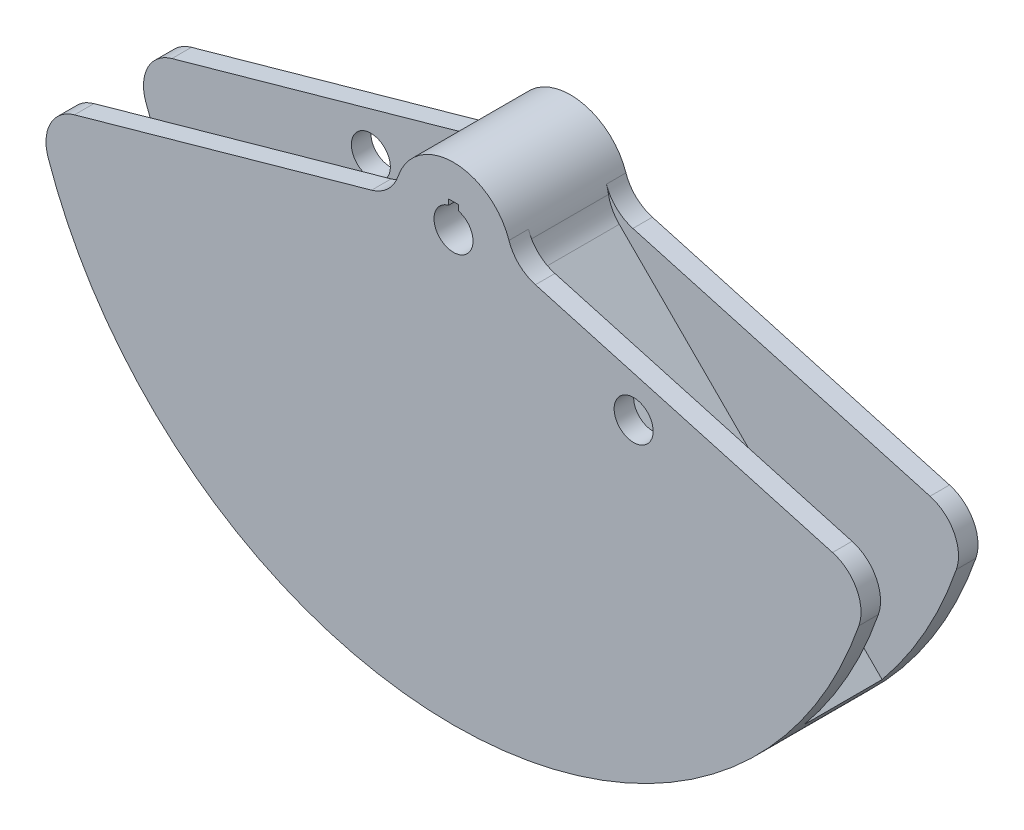
from build123d import *

# Parameters (mm, degrees)
SKETCH1_R               = 12.7
BOSS_EXTRUDE1_DEPTH     = 25.4
BOSS_EXTRUDE2_START     = 12.7
SKETCH5_R               = 12.7
BOSS_EXTRUDE2_DEPTH     = 12.7
SKETCH6_R               = 12.7
BOSS_EXTRUDE4_DEPTH     = 12.7
CUT_EXTRUDE1_DEPTH      = 388.27234671
CUT_EXTRUDE1_DEPTH_BACK = 388.27234671
SKETCH8_W               = 6.35
SKETCH8_H               = 6.35


with BuildPart() as part:
    # Sketch1 → Boss-Extrude1 (new, symmetric)
    with BuildSketch(Plane.XY):
        with BuildLine():
            Line((-215.695054603, -177.595054603), (-44.473355081, -6.373355081))
            ThreePointArc((-44.473355081, -6.373355081), (-39.956621227, -0.242188042), (-37.460320394, 6.952294297))
            ThreePointArc((-37.460320394, 6.952294297), (0, 38.1), (37.460320394, 6.952294297))
            ThreePointArc((37.460320394, 6.952294297), (39.956621227, -0.242188042), (44.473355081, -6.373355081))
            Line((44.473355081, -6.373355081), (215.695054603, -177.595054603))
            ThreePointArc((215.695054603, -177.595054603), (0, -279.4), (-215.695054603, -177.595054603))
        make_face()
        Circle(SKETCH1_R, mode=Mode.SUBTRACT)
    extrude(amount=BOSS_EXTRUDE1_DEPTH, both=True)

    # Sketch5 → Boss-Extrude2 (add)
    with BuildSketch(Plane.XY.offset(25.4).offset(BOSS_EXTRUDE2_START)):
        with BuildLine():
            Line((-246.90917958, -58.560550716), (-53.349403067, -4.276696281))
            ThreePointArc((-53.349403067, -4.276696281), (-42.702025606, 1.776101798), (-36.124925788, 12.107837827))
            ThreePointArc((-36.124925788, 12.107837827), (0, 38.1), (36.124925788, 12.107837827))
            ThreePointArc((36.124925788, 12.107837827), (42.702025606, 1.776101798), (53.349403067, -4.276696281))
            Line((53.349403067, -4.276696281), (246.90917958, -58.560550716))
            ThreePointArc((246.90917958, -58.560550716), (262.554103386, -71.238092264), (264.055410302, -91.318674379))
            ThreePointArc((264.055410302, -91.318674379), (0, -279.4), (-264.055410302, -91.318674379))
            ThreePointArc((-264.055410302, -91.318674379), (-262.554103386, -71.238092264), (-246.90917958, -58.560550716))
        make_face()
        Circle(SKETCH5_R, mode=Mode.SUBTRACT)
        with Locations((117.332700629, -48.60079591)):
            Circle(SKETCH5_R, mode=Mode.SUBTRACT)
    extrude(amount=-BOSS_EXTRUDE2_DEPTH)

    # Sketch6 → Boss-Extrude4 (add)
    with BuildSketch(Plane(origin=(0, 0, -25.4), x_dir=(-1, 0, 0), z_dir=(0, 0, -1))):
        with BuildLine():
            Line((-246.90917958, -58.560550716), (-53.349403067, -4.276696281))
            ThreePointArc((-53.349403067, -4.276696281), (-42.702025606, 1.776101798), (-36.124925788, 12.107837827))
            ThreePointArc((-36.124925788, 12.107837827), (0, 38.1), (36.124925788, 12.107837827))
            ThreePointArc((36.124925788, 12.107837827), (42.702025606, 1.776101798), (53.349403067, -4.276696281))
            Line((53.349403067, -4.276696281), (246.90917958, -58.560550716))
            ThreePointArc((246.90917958, -58.560550716), (262.554103386, -71.238092264), (264.055410302, -91.318674379))
            ThreePointArc((264.055410302, -91.318674379), (0, -279.4), (-264.055410302, -91.318674379))
            ThreePointArc((-264.055410302, -91.318674379), (-262.554103386, -71.238092264), (-246.90917958, -58.560550716))
        make_face()
        Circle(SKETCH6_R, mode=Mode.SUBTRACT)
        with Locations((117.332700629, -48.60079591)):
            Circle(SKETCH6_R, mode=Mode.SUBTRACT)
    extrude(amount=BOSS_EXTRUDE4_DEPTH)

    # Sketch8 → Cut-Extrude1 (cut, two sides: drawn at the far end of the back side and taken through both)
    with BuildSketch(Plane.XY.offset(-CUT_EXTRUDE1_DEPTH_BACK)):
        with Locations((0, 12.7)):
            Rectangle(SKETCH8_W, SKETCH8_H)
    extrude(amount=CUT_EXTRUDE1_DEPTH + CUT_EXTRUDE1_DEPTH_BACK, mode=Mode.SUBTRACT)


solid = part.part
